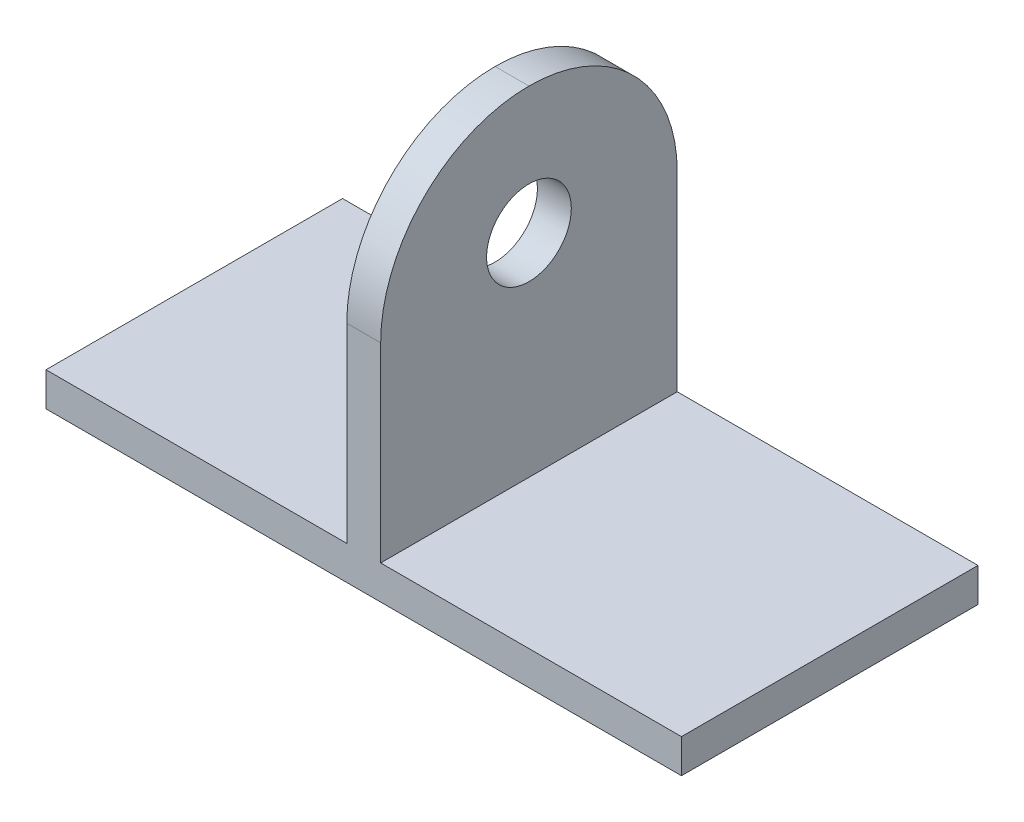
from build123d import *

# Parameters (mm, degrees)
SKETCH1_W           = 75
SKETCH1_H           = 35
BOSS_EXTRUDE1_DEPTH = 4
SKETCH2_W           = 4
SKETCH2_H           = 35
BOSS_EXTRUDE2_DEPTH = 40
SKETCH3_R           = 5
CUT_EXTRUDE1_DEPTH  = 62.664414373
FILLET1_R           = 17.5


with BuildPart() as part:
    # Sketch1 → Boss-Extrude1 (new body)
    with BuildSketch(Plane(origin=(0, 0, 0), x_dir=(1, 0, 0), z_dir=(0, 1, 0))):
        Rectangle(SKETCH1_W, SKETCH1_H)
    extrude(amount=BOSS_EXTRUDE1_DEPTH)

    # Sketch2 → Boss-Extrude2 (add)
    with BuildSketch(Plane(origin=(0, 4, 0), x_dir=(1, 0, 0), z_dir=(0, 1, 0))):
        Rectangle(SKETCH2_W, SKETCH2_H)
    extrude(amount=BOSS_EXTRUDE2_DEPTH)

    # Sketch3 → Cut-Extrude1 (cut, through all)
    with BuildSketch(Plane(origin=(2, 0, 0), x_dir=(0, 0, -1), z_dir=(1, 0, 0))):
        with Locations((0, 29)):
            Circle(SKETCH3_R)
    extrude(amount=-CUT_EXTRUDE1_DEPTH, mode=Mode.SUBTRACT)

    # Fillet1
    fillet1_edges = [part.edges().sort_by_distance(p)[0] for p in [
        (0, 44, -17.5),
        (0, 44, 17.5),
    ]]
    fillet(fillet1_edges, radius=FILLET1_R - 0.0001)  # a hair under: the kernel refuses the full size


solid = part.part
